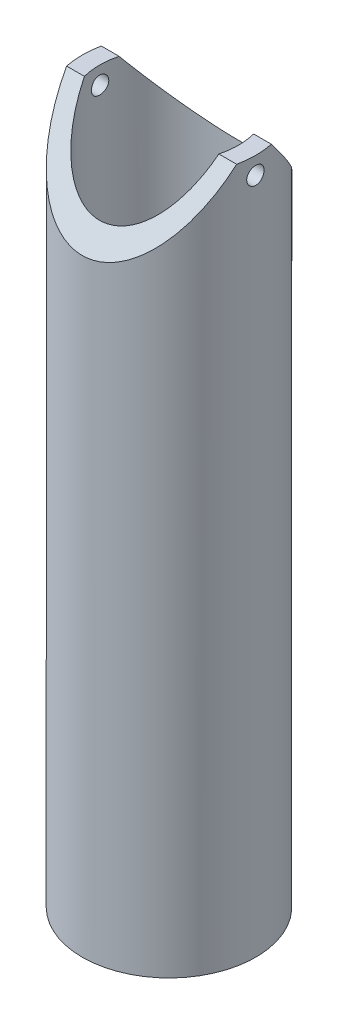
from build123d import *

# Parameters (mm, degrees)
SKETCH1_R               = 25
SKETCH1_R_2             = 20
BOSS_EXTRUDE1_DEPTH     = 200
CUT_EXTRUDE1_DEPTH      = 200
CUT_EXTRUDE1_DEPTH_BACK = 200
SKETCH2_R               = 2.5


with BuildPart() as part:
    # Sketch1 → Boss-Extrude1 (new body)
    with BuildSketch(Plane(origin=(0, 0, 0), x_dir=(1, 0, 0), z_dir=(0, 1, 0))):
        Circle(SKETCH1_R)
        Circle(SKETCH1_R_2, mode=Mode.SUBTRACT)
    extrude(amount=BOSS_EXTRUDE1_DEPTH)

    # Sketch2 → Cut-Extrude1 (cut, two sides: drawn at the far end of the back side and taken through both)
    with BuildSketch(Plane(origin=(0, 0, 0), x_dir=(0, 0, -1), z_dir=(1, 0, 0)).offset(-CUT_EXTRUDE1_DEPTH_BACK)):
        with Locations((0, 195)):
            Circle(SKETCH2_R)
        Polygon((25, 175), (5, 200), (-5, 200), (-25, 175), (-25, 205.937261936), (25, 205.937261936), align=None)
    extrude(amount=CUT_EXTRUDE1_DEPTH + CUT_EXTRUDE1_DEPTH_BACK, mode=Mode.SUBTRACT)


solid = part.part
